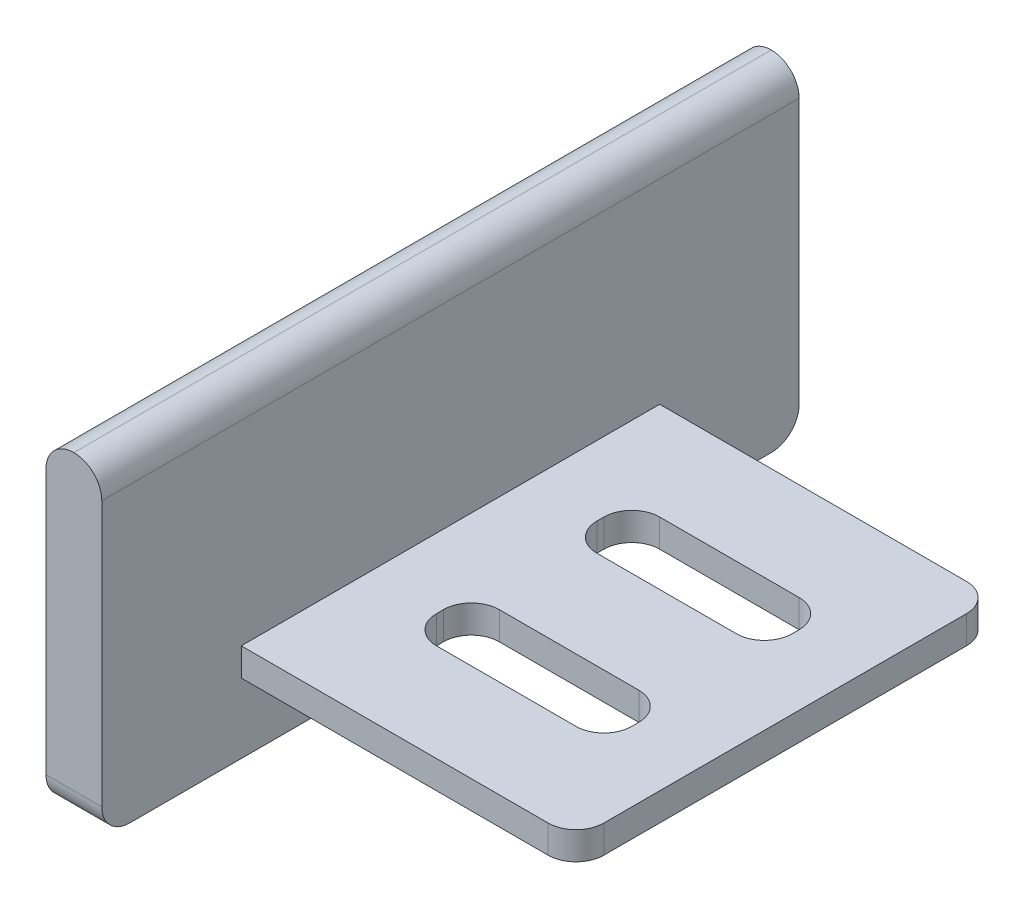
from build123d import *

# Parameters (mm, degrees)
EXTRUDE_1_DEPTH     = 50
SKETCH_2_W          = 24
SKETCH_2_H          = 10
SKETCH_2_W_2        = 14
SKETCH_2_H_2        = 4.5
CUT_EXTRUDE_1_DEPTH = 50
FILLET_1_R          = 2
FILLET_2_R          = 2
FILLET_3_R          = 2
FILLET_4_R          = 2
FILLET_5_R          = 2
FILLET_6_R          = 2
FILLET_7_R          = 2
FILLET_8_R          = 2
FILLET_9_R          = 2
FILLET_10_R         = 2
FILLET_11_R         = 2
FILLET_12_R         = 2
FILLET_14_R         = 2
FILLET_15_R         = 2
SKETCH_3_R          = 1
CUT_EXTRUDE_2_DEPTH = 7


with BuildPart() as part:
    # 草图1 → 凸台-拉伸1 (new body)
    with BuildSketch(Plane.XY):
        Polygon((-4.784615385, 19.338461538), (-4.784615385, -3.661538462), (-0.784615385, -3.661538462), (-0.784615385, 1.338461538), (23.215384615, 1.338461538), (23.215384615, 3.338461538), (-0.784615385, 3.338461538), (-0.784615385, 19.338461538), align=None)
    extrude(amount=EXTRUDE_1_DEPTH)

    # 草图2 → 切除-拉伸1 (cut)
    with BuildSketch(Plane(origin=(0, 3.338461538, 0), x_dir=(1, 0, 0), z_dir=(0, 1, 0))):
        with Locations((11.215384615, -45)):
            Rectangle(SKETCH_2_W, SKETCH_2_H)
        with Locations((11.215384615, -30.75)):
            Rectangle(SKETCH_2_W_2, SKETCH_2_H_2)
        with Locations((11.215384615, -19.25)):
            Rectangle(SKETCH_2_W_2, SKETCH_2_H_2)
        with Locations((11.215384615, -5)):
            Rectangle(SKETCH_2_W, SKETCH_2_H)
    extrude(amount=-CUT_EXTRUDE_1_DEPTH, mode=Mode.SUBTRACT)

    # 圆角1
    fillet_1_edges = [part.edges().sort_by_distance(p)[0] for p in [
        (23.215384615, 2.338461538, 40),
    ]]
    fillet(fillet_1_edges, radius=FILLET_1_R)

    # 圆角2
    fillet_2_edges = [part.edges().sort_by_distance(p)[0] for p in [
        (23.215384615, 2.338461538, 10),
    ]]
    fillet(fillet_2_edges, radius=FILLET_2_R)

    # 圆角3
    fillet_3_edges = [part.edges().sort_by_distance(p)[0] for p in [
        (4.215384615, 2.338461538, 28.5),
    ]]
    fillet(fillet_3_edges, radius=FILLET_3_R)

    # 圆角4
    fillet_4_edges = [part.edges().sort_by_distance(p)[0] for p in [
        (4.215384615, 2.338461538, 33),
    ]]
    fillet(fillet_4_edges, radius=FILLET_4_R)

    # 圆角5
    fillet_5_edges = [part.edges().sort_by_distance(p)[0] for p in [
        (4.215384615, 2.338461538, 17),
    ]]
    fillet(fillet_5_edges, radius=FILLET_5_R)

    # 圆角6
    fillet_6_edges = [part.edges().sort_by_distance(p)[0] for p in [
        (4.215384615, 2.338461538, 21.5),
    ]]
    fillet(fillet_6_edges, radius=FILLET_6_R)

    # 圆角7
    fillet_7_edges = [part.edges().sort_by_distance(p)[0] for p in [
        (18.215384615, 2.338461538, 17),
    ]]
    fillet(fillet_7_edges, radius=FILLET_7_R)

    # 圆角8
    fillet_8_edges = [part.edges().sort_by_distance(p)[0] for p in [
        (18.215384615, 2.338461538, 33),
    ]]
    fillet(fillet_8_edges, radius=FILLET_8_R)

    # 圆角9
    fillet_9_edges = [part.edges().sort_by_distance(p)[0] for p in [
        (18.215384615, 2.338461538, 28.5),
    ]]
    fillet(fillet_9_edges, radius=FILLET_9_R)

    # 圆角10
    fillet_10_edges = [part.edges().sort_by_distance(p)[0] for p in [
        (18.215384615, 2.338461538, 21.5),
    ]]
    fillet(fillet_10_edges, radius=FILLET_10_R)

    # 圆角11
    fillet_11_edges = [part.edges().sort_by_distance(p)[0] for p in [
        (-0.784615385, 19.338461538, 25),
    ]]
    fillet(fillet_11_edges, radius=FILLET_11_R)

    # 圆角12
    fillet_12_edges = [part.edges().sort_by_distance(p)[0] for p in [
        (-4.784615385, 19.338461538, 25),
    ]]
    fillet(fillet_12_edges, radius=FILLET_12_R - 0.0001)  # a hair under: the kernel refuses the full size

    # 圆角14
    fillet_14_edges = [part.edges().sort_by_distance(p)[0] for p in [
        (-2.784615385, -3.661538462, 50),
    ]]
    fillet(fillet_14_edges, radius=FILLET_14_R)

    # 圆角15
    fillet_15_edges = [part.edges().sort_by_distance(p)[0] for p in [
        (-2.784615385, -3.661538462, 0),
    ]]
    fillet(fillet_15_edges, radius=FILLET_15_R)

    # 草图3 → 切除-拉伸2 (cut)
    with BuildSketch(Plane.XZ.offset(3.661538462)):
        with Locations(Location((-2.784615385, 42.5, 0), (0, 0, 270))):
            Circle(SKETCH_3_R)
        with Locations(Location((-2.784615385, 7.5, 0), (0, 0, 90))):
            Circle(SKETCH_3_R)
    extrude(amount=-CUT_EXTRUDE_2_DEPTH, mode=Mode.SUBTRACT)


solid = part.part
